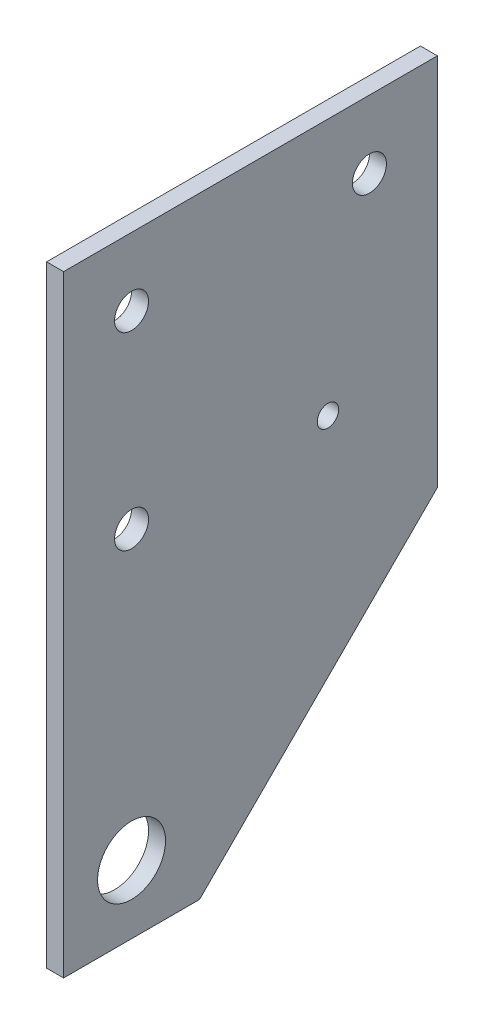
from build123d import *

# Parameters (mm, degrees)
SKETCH1_R           = 2
SKETCH1_R_2         = 6.35
SKETCH1_R_3         = 3.175
BOSS_EXTRUDE1_DEPTH = 3.175


with BuildPart() as part:
    # Sketch1 → Boss-Extrude1 (new body)
    with BuildSketch(Plane(origin=(0, 0, 0), x_dir=(0, 0, -1), z_dir=(1, 0, 0))):
        Polygon((-12.7, 101.6), (57.15, 101.6), (57.15, 31.75), (12.7, -12.7), (-12.7, -12.7), align=None)
        with Locations((36.695774871, 53.601042741)):
            Circle(SKETCH1_R, mode=Mode.SUBTRACT)
        Circle(SKETCH1_R_2, mode=Mode.SUBTRACT)
        with Locations((0, 88.9)):
            Circle(SKETCH1_R_3, mode=Mode.SUBTRACT)
        with Locations((44.45, 88.9)):
            Circle(SKETCH1_R_3, mode=Mode.SUBTRACT)
        with Locations((0, 53.601042741)):
            Circle(SKETCH1_R_3, mode=Mode.SUBTRACT)
    extrude(amount=BOSS_EXTRUDE1_DEPTH)


solid = part.part
